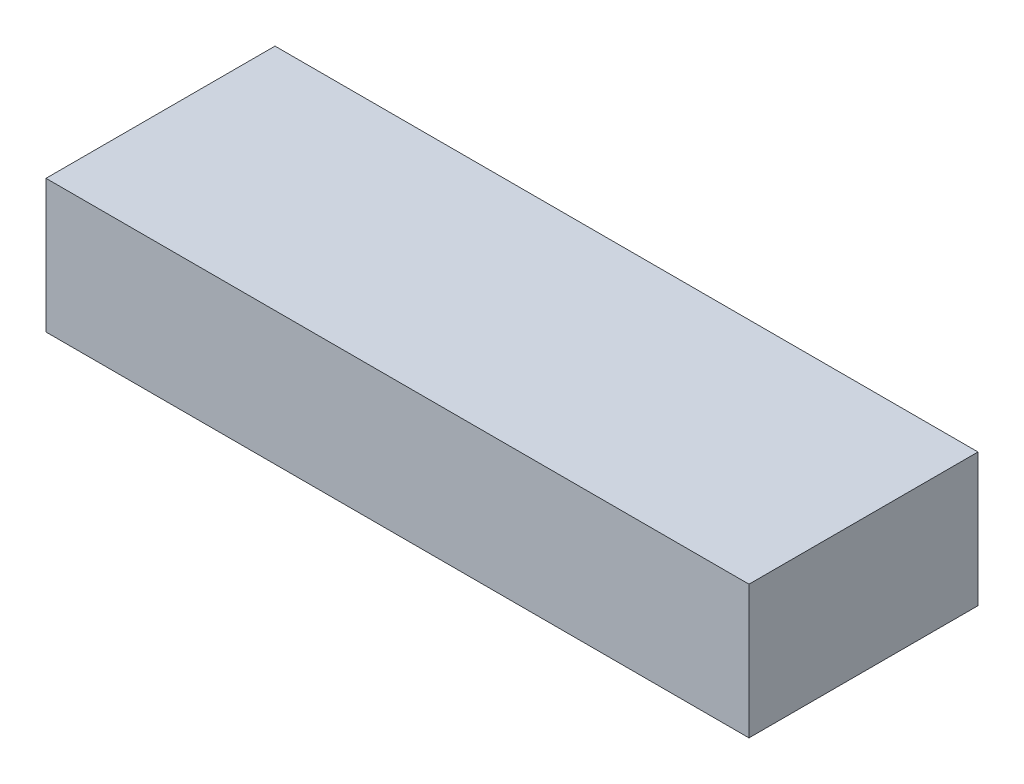
from build123d import *

# Parameters (mm, degrees)
SKETCH1_W           = 132
SKETCH1_H           = 43
BOSS_EXTRUDE1_DEPTH = 25


with BuildPart() as part:
    # Sketch1 → Boss-Extrude1 (new body)
    with BuildSketch(Plane(origin=(0, 0, 0), x_dir=(1, 0, 0), z_dir=(0, 1, 0))):
        Rectangle(SKETCH1_W, SKETCH1_H)
    extrude(amount=BOSS_EXTRUDE1_DEPTH)


solid = part.part
